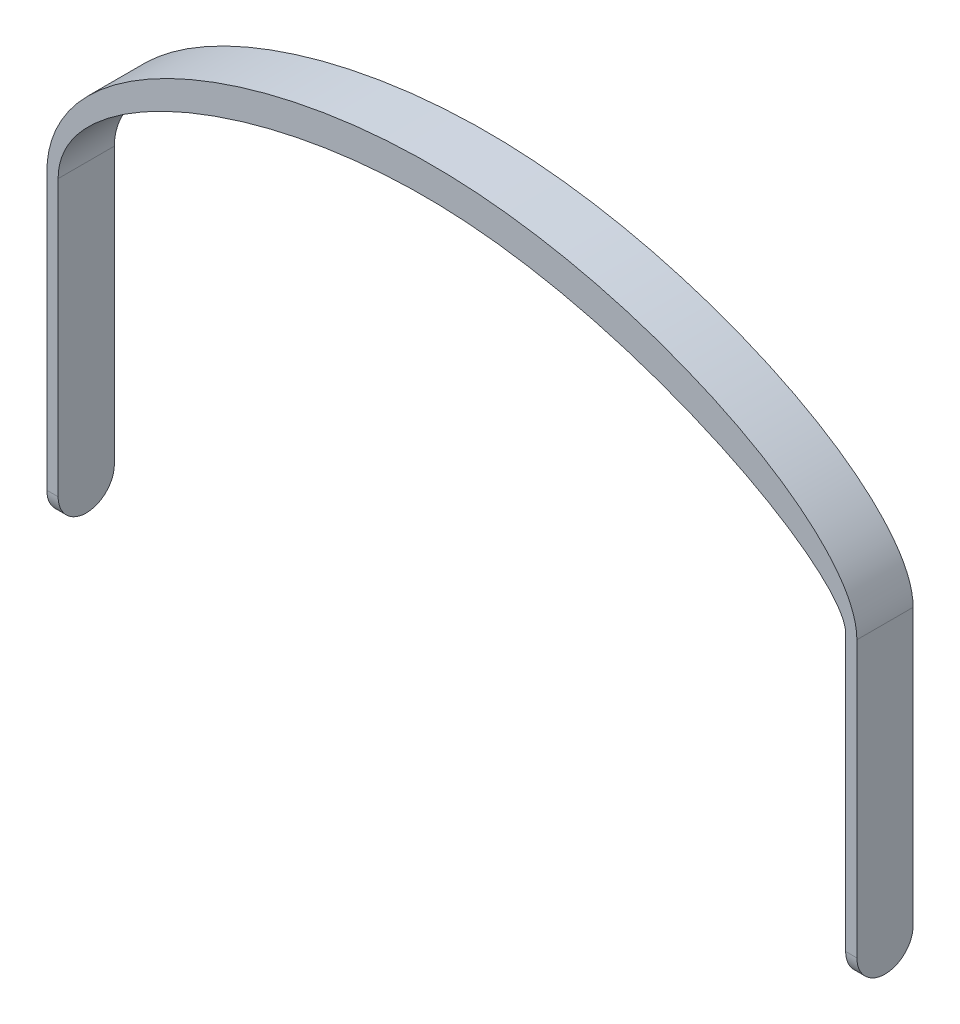
from build123d import *

# Parameters (mm, degrees)
BOSS_EXTRUDE2_DEPTH = 25.4
FILLET1_R           = 12.7
FILLET2_R           = 12.7


with BuildPart() as part:
    # Sketch3 → Boss-Extrude2 (new body)
    with BuildSketch(Plane.XY):
        with BuildLine():
            Line((-177.8, 7.57860608), (-177.8, -129.54))
            Line((-177.8, -129.54), (-182.88, -129.54))
            Line((-182.88, -129.54), (-182.88, 7.57860608))
            add(Edge.make_bspline(
                [(182.88, 7.57860608), (182.88, 46.763821962), (0, 141.394473708), (-182.88, 58.90806056), (-182.88, 7.57860608)],
                knots=[0, 0, 0, 0, 0.5, 1, 1, 1, 1], degree=3))
            Line((182.88, 7.57860608), (182.88, -129.54))
            Line((182.88, -129.54), (177.8, -129.54))
            Line((177.8, -129.54), (177.8, 7.57860608))
            add(Edge.make_bspline(
                [(-177.8, 7.57860608), (-177.8, 46.300078228), (0, 128.042210108), (177.8, 30.017127825), (177.8, 7.57860608)],
                knots=[0, 0, 0, 0, 0.5, 1, 1, 1, 1], degree=3))
        make_face()
    extrude(amount=BOSS_EXTRUDE2_DEPTH)

    # Fillet1
    fillet1_edges = [part.edges().sort_by_distance(p)[0] for p in [
        (-180.34, -129.54, 0),
        (-180.34, -129.54, 25.4),
    ]]
    fillet(fillet1_edges, radius=FILLET1_R - 0.0001)  # a hair under: the kernel refuses the full size

    # Fillet2
    fillet2_edges = [part.edges().sort_by_distance(p)[0] for p in [
        (180.34, -129.54, 0),
        (180.34, -129.54, 25.4),
    ]]
    fillet(fillet2_edges, radius=FILLET2_R - 0.0001)  # a hair under: the kernel refuses the full size


solid = part.part
